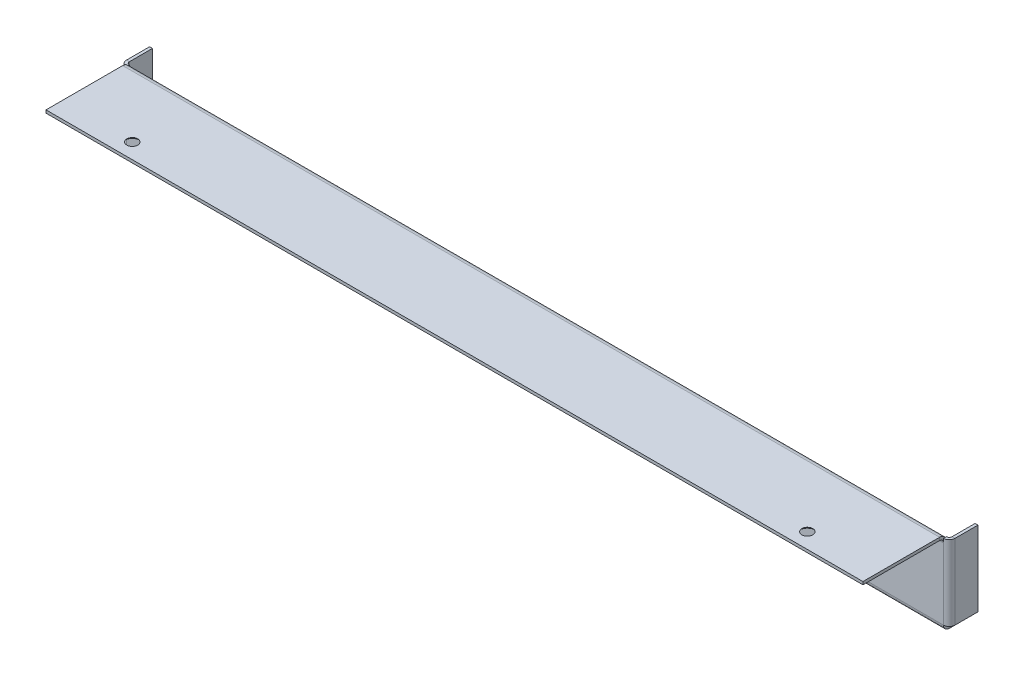
from build123d import *

# Parameters (mm, degrees)
SKETCH_1_W                       = 426
SKETCH_1_H                       = 39.2
SM_BASE_FLANGE_1_DEPTH           = 1.5
SM_EDGE_FLANGE_2_DEPTH           = 39.2
SM_EDGE_FLANGE_3_DEPTH           = 426
SM_EDGE_FLANGE_4_DEPTH           = 39.2
SM_EDGE_FLANGE_5_STRIP_W         = 10
SM_EDGE_FLANGE_5_STRIP_H         = 1.5
SM_EDGE_FLANGE_5_STRIP_CUT_DEPTH = 426
SM_EDGE_FLANGE_5_DEPTH           = 426
SKETCH_28_R                      = 2.3
CUT_EXTRUDE_1_DEPTH              = 434.111810044
CHAMFER_1_SIZE                   = 2.05


# Sheet-metal steps are written as plain solids
with BuildPart() as part:
    # Sketch 1 → Базовая кромка1 (new body)
    with BuildSketch(Plane.XY):
        with Locations((213, 19.6)):
            Rectangle(SKETCH_1_W, SKETCH_1_H)
    extrude(amount=-SM_BASE_FLANGE_1_DEPTH)

    # Ребро-кромка2 section (across the edge) → Ребро-кромка2 (add)
    with BuildSketch(Plane(origin=(-1.5, 0, -1.5), x_dir=(1, 0, 0), z_dir=(0, 1, 0))):
        with BuildLine():
            Line((-1.5, 1.5), (-1.5, 13.5))
            Line((-1.5, 13.5), (0, 13.5))
            Line((0, 13.5), (0, 1.5))
            ThreePointArc((0, 1.5), (0.439339828, 0.439339828), (1.5, 0))
            Line((1.5, 0), (1.5, -1.5))
            ThreePointArc((1.5, -1.5), (-0.621320344, -0.621320344), (-1.5, 1.5))
        make_face()
    extrude(amount=SM_EDGE_FLANGE_2_DEPTH)

    # Ребро-кромка3 section (across the edge) → Ребро-кромка3 (add)
    with BuildSketch(Plane(origin=(426, -1.5, -1.5), x_dir=(0, 1, 0), z_dir=(-1, 0, 0))):
        with BuildLine():
            Line((-1.5, 1.5), (-1.5, 13.5))
            Line((-1.5, 13.5), (0, 13.5))
            Line((0, 13.5), (0, 1.5))
            ThreePointArc((0, 1.5), (0.439339828, 0.439339828), (1.5, 0))
            Line((1.5, 0), (1.5, -1.5))
            ThreePointArc((1.5, -1.5), (-0.621320344, -0.621320344), (-1.5, 1.5))
        make_face()
    extrude(amount=SM_EDGE_FLANGE_3_DEPTH)

    # Ребро-кромка4 section (across the edge) → Ребро-кромка4 (add)
    with BuildSketch(Plane(origin=(427.5, 39.2, -1.5), x_dir=(-1, 0, 0), z_dir=(0, -1, 0))):
        with BuildLine():
            Line((-1.5, 1.5), (-1.5, 13.5))
            Line((-1.5, 13.5), (0, 13.5))
            Line((0, 13.5), (0, 1.5))
            ThreePointArc((0, 1.5), (0.439339828, 0.439339828), (1.5, 0))
            Line((1.5, 0), (1.5, -1.5))
            ThreePointArc((1.5, -1.5), (-0.621320344, -0.621320344), (-1.5, 1.5))
        make_face()
    extrude(amount=SM_EDGE_FLANGE_4_DEPTH)

    # Ребро-кромка5 strip (across the edge) → Ребро-кромка5 strip cut (cut)
    with BuildSketch(Plane(origin=(426, 39.2, 0), x_dir=(0, -1, 0), z_dir=(-1, 0, 0))):
        with Locations((-3, -0.75)):
            Rectangle(SM_EDGE_FLANGE_5_STRIP_W, SM_EDGE_FLANGE_5_STRIP_H)
    extrude(amount=SM_EDGE_FLANGE_5_STRIP_CUT_DEPTH, mode=Mode.SUBTRACT)

    # Ребро-кромка5 section (across the edge) → Ребро-кромка5 (add)
    with BuildSketch(Plane(origin=(426, 39.2, 0), x_dir=(0, -1, 0), z_dir=(-1, 0, 0))):
        with BuildLine():
            Line((-1.5, 2), (-1.5, 42))
            Line((-1.5, 42), (0, 42))
            Line((0, 42), (0, 2))
            ThreePointArc((0, 2), (0.585786438, 0.585786438), (2, 0))
            Line((2, 0), (2, -1.5))
            ThreePointArc((2, -1.5), (-0.474873734, -0.474873734), (-1.5, 2))
        make_face()
    extrude(amount=SM_EDGE_FLANGE_5_DEPTH)

    # Эскиз28 → Вырез-Вытянуть1 (cut, through all)
    with BuildSketch(Plane.XZ.offset(-39.2)):
        with Locations(Location((37, 34, 0), (0, 0, 270))):
            Circle(SKETCH_28_R)
        with Locations(Location((389, 34, 0), (0, 0, 270))):
            Circle(SKETCH_28_R)
    extrude(amount=-CUT_EXTRUDE_1_DEPTH, mode=Mode.SUBTRACT)

    # Фаска1
    # the kernel refuses this chamfer: 2.05 mm, written as the material it takes off along each edge
    with BuildSketch(Plane(origin=(389, 39.2, 34), x_dir=(0, 0, -1), z_dir=(-1, 0, 0))) as chamfer_1_piece_1:
        Polygon((2.3 + CHAMFER_1_SIZE, 0), (2.3, -CHAMFER_1_SIZE), (2.3, 0), align=None)
    revolve(axis=Axis((389, 39.2, 34), (0, -1, 0)), mode=Mode.SUBTRACT)
    with BuildSketch(Plane(origin=(37, 39.2, 34), x_dir=(0, 0, -1), z_dir=(-1, 0, 0))) as chamfer_1_piece_2:
        Polygon((2.3 + CHAMFER_1_SIZE, 0), (2.3, -CHAMFER_1_SIZE), (2.3, 0), align=None)
    revolve(axis=Axis((37, 39.2, 34), (0, -1, 0)), mode=Mode.SUBTRACT)


solid = part.part
